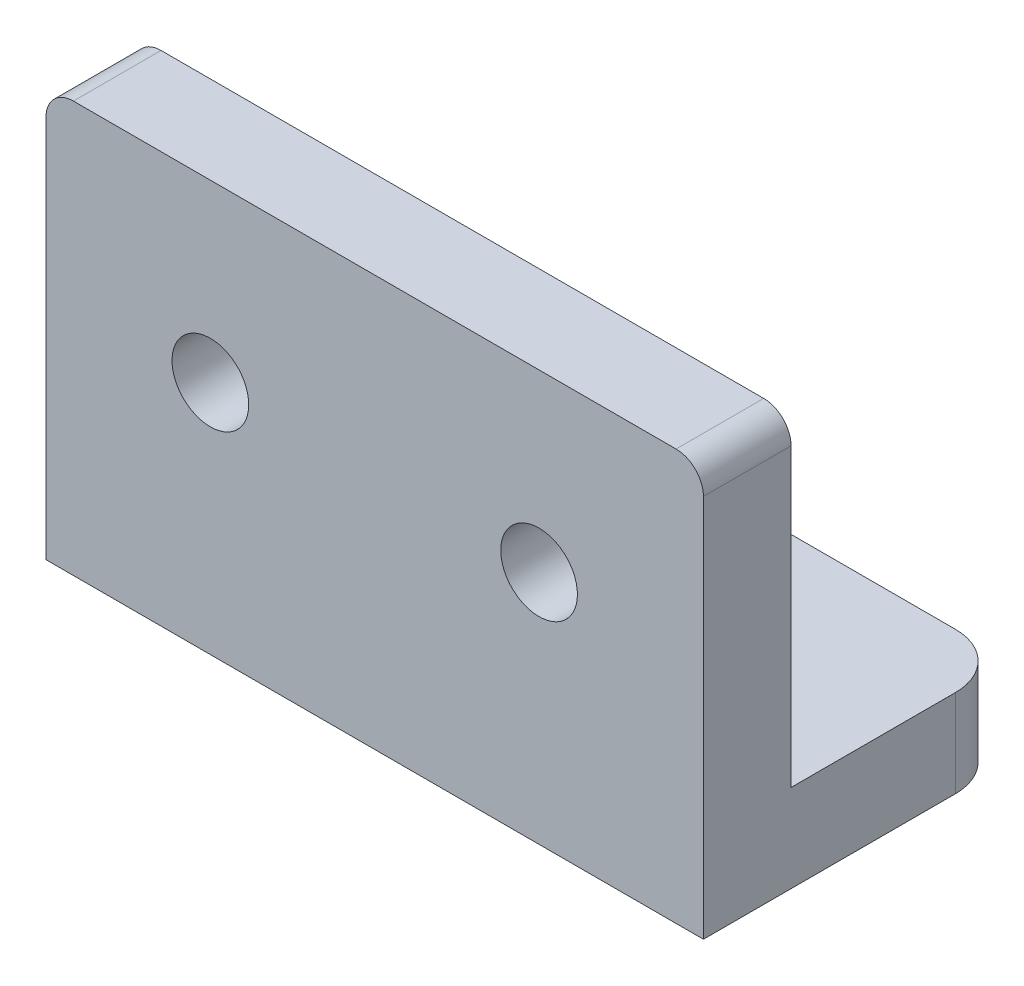
from build123d import *

# Parameters (mm, degrees)
SKETCH1_W           = 30
SKETCH1_H           = 18.75
BOSS_EXTRUDE1_DEPTH = 4
FILLET1_R           = 1.25
SKETCH3_R           = 1.75
CUT_EXTRUDE1_DEPTH  = 10
SKETCH4_W           = 30
SKETCH4_H           = 4
BOSS_EXTRUDE2_DEPTH = 10
FILLET2_R           = 2.5


with BuildPart() as part:
    # Sketch1 → Boss-Extrude1 (new body)
    with BuildSketch(Plane.XY):
        Rectangle(SKETCH1_W, SKETCH1_H)
    extrude(amount=BOSS_EXTRUDE1_DEPTH)

    # Fillet1
    fillet1_edges = [part.edges().sort_by_distance(p)[0] for p in [
        (15, 9.375, 2),
        (-15, 9.375, 2),
    ]]
    fillet(fillet1_edges, radius=FILLET1_R)

    # Sketch3 → Cut-Extrude1 (cut)
    with BuildSketch(Plane.XY.offset(4)):
        with Locations((-7.5, 1.375)):
            Circle(SKETCH3_R)
        with Locations((7.5, 1.375)):
            Circle(SKETCH3_R)
    extrude(amount=-CUT_EXTRUDE1_DEPTH, mode=Mode.SUBTRACT)

    # Sketch4 → Boss-Extrude2 (add)
    with BuildSketch(Plane(origin=(0, 0, 0), x_dir=(-1, 0, 0), z_dir=(0, 0, -1))):
        with Locations((0, -7.375)):
            Rectangle(SKETCH4_W, SKETCH4_H)
    extrude(amount=BOSS_EXTRUDE2_DEPTH)

    # Fillet2
    fillet2_edges = [part.edges().sort_by_distance(p)[0] for p in [
        (15, -7.375, -10),
        (-15, -7.375, -10),
    ]]
    fillet(fillet2_edges, radius=FILLET2_R)


solid = part.part
